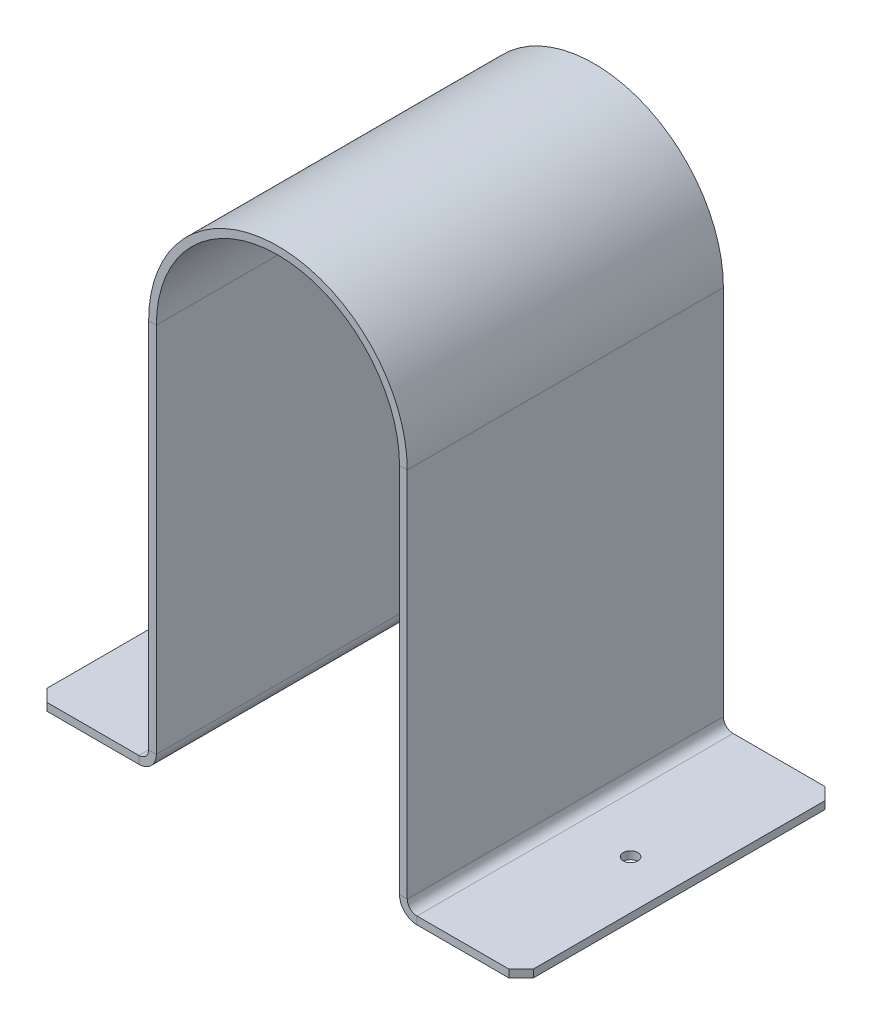
from build123d import *

# Parameters (mm, degrees)
BASE_FLANGE1_DEPTH = 65
SKETCH6_R          = 3
CUT_EXTRUDE1_DEPTH = 10
CHAMFER1_SIZE      = 5


# Sheet-metal steps are written as plain solids
with BuildPart() as part:
    # Sketch1 → Base-Flange1 (new, symmetric)
    with BuildSketch(Plane.XY):
        with BuildLine():
            Line((-100, 0), (-57.175, 0))
            ThreePointArc((-57.175, 0), (-52.101508845, 2.101508845), (-50, 7.175))
            Line((-50, 7.175), (-50, 160))
            ThreePointArc((-50, 160), (0, 210), (50, 160))
            Line((50, 160), (50, 7.175))
            ThreePointArc((50, 7.175), (52.101508845, 2.101508845), (57.175, 0))
            Line((57.175, 0), (100, 0))
            Line((100, 0), (100, 3.175))
            Line((100, 3.175), (57.175, 3.175))
            ThreePointArc((57.175, 3.175), (54.346572875, 4.346572875), (53.175, 7.175))
            Line((53.175, 7.175), (53.175, 160))
            ThreePointArc((53.175, 160), (0, 213.175), (-53.175, 160))
            Line((-53.175, 160), (-53.175, 7.175))
            ThreePointArc((-53.175, 7.175), (-54.346572875, 4.346572875), (-57.175, 3.175))
            Line((-57.175, 3.175), (-100, 3.175))
            Line((-100, 3.175), (-100, 0))
        make_face()
    extrude(amount=BASE_FLANGE1_DEPTH, both=True)

    # Sketch6 → Cut-Extrude1 (cut)
    with BuildSketch(Plane(origin=(0, 3.175, 0), x_dir=(1, 0, 0), z_dir=(0, 1, 0))):
        with Locations(Location((80, 0, 0), (0, 0, 270))):
            Circle(SKETCH6_R)
        with Locations(Location((-80, 0, 0), (0, 0, 270))):
            Circle(SKETCH6_R)
    extrude(amount=-CUT_EXTRUDE1_DEPTH, mode=Mode.SUBTRACT)

    # Chamfer1
    chamfer1_edges = [part.edges().sort_by_distance(p)[0] for p in [
        (-100, 1.5875, -65),
        (100, 1.5875, -65),
        (-100, 1.5875, 65),
        (100, 1.5875, 65),
    ]]
    chamfer(chamfer1_edges, length=CHAMFER1_SIZE)


solid = part.part
